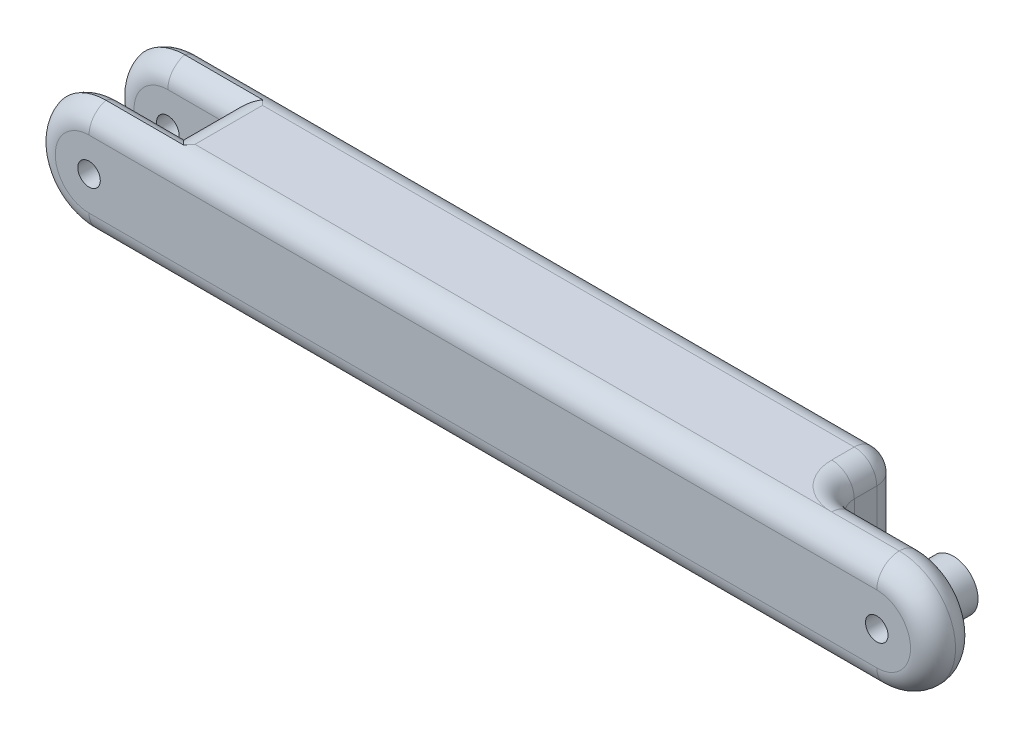
from build123d import *
from build123d.topology import SkipClean

# Parameters (mm, degrees)
SKETCH_1_R               = 0.5
EXTRUDE_1_DEPTH          = 5
CUT_EXTRUDE_1_DEPTH      = 1
CUT_EXTRUDE_1_DEPTH_BACK = 1
CUT_EXTRUDE_1_START      = -2.5
SKETCH_2_R               = 3
SKETCH_7_W               = 8
SKETCH_7_H               = 5
CUT_EXTRUDE_3_DEPTH      = 3
EXTRUDE_START            = 1.4
SKETCH_8_R               = 1.1
SKETCH_8_R_2             = 0.5
EXTRUDE_3_DEPTH          = 1.4
FILLET_1_R               = 1


with BuildPart() as part:
    # 草图1 → 凸台-拉伸1 (new body)
    with BuildSketch(Plane.XY):
        with BuildLine():
            Line((-13.5, 2.5), (21.5, 2.5))
            ThreePointArc((21.5, 2.5), (24, 0), (21.5, -2.5))
            Line((21.5, -2.5), (-13.5, -2.5))
            ThreePointArc((-13.5, -2.5), (-16, 0), (-13.5, 2.5))
        make_face()
        with Locations((-13.5, 0)):
            Circle(SKETCH_1_R, mode=Mode.SUBTRACT)
        with Locations((21.5, 0)):
            Circle(SKETCH_1_R, mode=Mode.SUBTRACT)
    extrude(amount=EXTRUDE_1_DEPTH)

    # 草图2 → 切除-拉伸1 (cut, two sides: drawn at the far end of the back side and taken through both)
    with BuildSketch(Plane(origin=(0, 0, 0), x_dir=(-1, 0, 0), z_dir=(0, 0, -1)).offset(CUT_EXTRUDE_1_START - CUT_EXTRUDE_1_DEPTH_BACK)):
        with Locations((13.5, 0)):
            Circle(SKETCH_2_R)
    extrude(amount=CUT_EXTRUDE_1_DEPTH + CUT_EXTRUDE_1_DEPTH_BACK, mode=Mode.SUBTRACT)

    # 草图7 → 切除-拉伸3 (cut)
    with BuildSketch(Plane(origin=(0, 0, 0), x_dir=(-1, 0, 0), z_dir=(0, 0, -1))):
        with Locations((-21.5, 0)):
            Rectangle(SKETCH_7_W, SKETCH_7_H)
    extrude(amount=-CUT_EXTRUDE_3_DEPTH, mode=Mode.SUBTRACT)

    # 草图8 → 凸台-拉伸3 (add)
    with SkipClean():  # the faces are left unmerged after this step: merging them gives an invalid solid
        with BuildSketch(Plane(origin=(0, 0, 3), x_dir=(-1, 0, 0), z_dir=(0, 0, -1)).offset(EXTRUDE_START)):
            with Locations((-21.5, 0)):
                Circle(SKETCH_8_R)
            with Locations((-21.5, 0)):
                Circle(SKETCH_8_R_2, mode=Mode.SUBTRACT)
        extrude(amount=-EXTRUDE_3_DEPTH)

    # 圆角1
    # the kernel refuses this fillet: 1 mm, written as the material it adds along each edge
    with BuildSketch(Plane(origin=(17.5, 2.5, 3), x_dir=(1, 0, 0), z_dir=(0, -1, 0))) as fillet_1_piece_1:
        with BuildLine():
            CenterArc((FILLET_1_R, -FILLET_1_R), FILLET_1_R, 90, 90)
            Line((0, -FILLET_1_R), (-FILLET_1_R * 0.02, -FILLET_1_R))
            Line((-FILLET_1_R * 0.02, -FILLET_1_R), (-FILLET_1_R * 0.02, FILLET_1_R * 0.02))
            Line((-FILLET_1_R * 0.02, FILLET_1_R * 0.02), (FILLET_1_R, FILLET_1_R * 0.02))
            Line((FILLET_1_R, FILLET_1_R * 0.02), (FILLET_1_R, 0))
        make_face()
    extrude(amount=5)
    # the kernel refuses this fillet: 1 mm, written as the material it takes off along each edge
    with BuildSketch(Plane(origin=(-13.5, -2.5, 1.5), x_dir=(0, 0, -1), z_dir=(1, 0, 0))) as fillet_1_2_piece_1_section:
        with BuildLine():
            CenterArc((FILLET_1_R, FILLET_1_R), FILLET_1_R, 180, 90)
            Line((0, FILLET_1_R), (-FILLET_1_R * 0.02, FILLET_1_R))
            Line((-FILLET_1_R * 0.02, FILLET_1_R), (-FILLET_1_R * 0.02, -FILLET_1_R * 0.02))
            Line((-FILLET_1_R * 0.02, -FILLET_1_R * 0.02), (FILLET_1_R, -FILLET_1_R * 0.02))
            Line((FILLET_1_R, -FILLET_1_R * 0.02), (FILLET_1_R, 0))
        make_face()
    fillet_1_2_piece_1 = extrude(amount=4.158312395, mode=Mode.PRIVATE)
    fillet_1_2_piece_1 = fillet_1_2_piece_1 & Plane(origin=(-13.5, 0, 1.28947416), x_dir=(-1, 0, 0), z_dir=(0, 0, -1)) * Cylinder(3, 13, mode=Mode.PRIVATE)
    add(fillet_1_2_piece_1, mode=Mode.SUBTRACT)
    with BuildSketch(Plane(origin=(-9.341687605, 2.5, 1.5), x_dir=(0, 0, -1), z_dir=(-1, 0, 0))) as fillet_1_2_piece_2_section:
        with BuildLine():
            CenterArc((FILLET_1_R, FILLET_1_R), FILLET_1_R, 180, 90)
            Line((0, FILLET_1_R), (-FILLET_1_R * 0.02, FILLET_1_R))
            Line((-FILLET_1_R * 0.02, FILLET_1_R), (-FILLET_1_R * 0.02, -FILLET_1_R * 0.02))
            Line((-FILLET_1_R * 0.02, -FILLET_1_R * 0.02), (FILLET_1_R, -FILLET_1_R * 0.02))
            Line((FILLET_1_R, -FILLET_1_R * 0.02), (FILLET_1_R, 0))
        make_face()
    fillet_1_2_piece_2 = extrude(amount=4.158312395, mode=Mode.PRIVATE)
    fillet_1_2_piece_2 = fillet_1_2_piece_2 & Plane(origin=(-13.5, 0, 1.289475039), x_dir=(-1, 0, 0), z_dir=(0, 0, -1)) * Cylinder(3, 13, mode=Mode.PRIVATE)
    add(fillet_1_2_piece_2, mode=Mode.SUBTRACT)
    with BuildSketch(Plane(origin=(-13.5, -2.5, 3.5), x_dir=(0, 0, 1), z_dir=(1, 0, 0))) as fillet_1_2_piece_3_section:
        with BuildLine():
            CenterArc((FILLET_1_R, -FILLET_1_R), FILLET_1_R, 90, 90)
            Line((0, -FILLET_1_R), (-FILLET_1_R * 0.02, -FILLET_1_R))
            Line((-FILLET_1_R * 0.02, -FILLET_1_R), (-FILLET_1_R * 0.02, FILLET_1_R * 0.02))
            Line((-FILLET_1_R * 0.02, FILLET_1_R * 0.02), (FILLET_1_R, FILLET_1_R * 0.02))
            Line((FILLET_1_R, FILLET_1_R * 0.02), (FILLET_1_R, 0))
        make_face()
    fillet_1_2_piece_3 = extrude(amount=4.158312395, mode=Mode.PRIVATE)
    fillet_1_2_piece_3 = fillet_1_2_piece_3 & Plane(origin=(-13.5, 0, 3.71052584), x_dir=(-1, 0, 0), z_dir=(0, 0, -1)) * Cylinder(3, 13, mode=Mode.PRIVATE)
    add(fillet_1_2_piece_3, mode=Mode.SUBTRACT)
    with BuildSketch(Plane(origin=(-9.341687605, 2.5, 3.5), x_dir=(0, 0, 1), z_dir=(-1, 0, 0))) as fillet_1_2_piece_4_section:
        with BuildLine():
            CenterArc((FILLET_1_R, -FILLET_1_R), FILLET_1_R, 90, 90)
            Line((0, -FILLET_1_R), (-FILLET_1_R * 0.02, -FILLET_1_R))
            Line((-FILLET_1_R * 0.02, -FILLET_1_R), (-FILLET_1_R * 0.02, FILLET_1_R * 0.02))
            Line((-FILLET_1_R * 0.02, FILLET_1_R * 0.02), (FILLET_1_R, FILLET_1_R * 0.02))
            Line((FILLET_1_R, FILLET_1_R * 0.02), (FILLET_1_R, 0))
        make_face()
    fillet_1_2_piece_4 = extrude(amount=4.158312395, mode=Mode.PRIVATE)
    fillet_1_2_piece_4 = fillet_1_2_piece_4 & Plane(origin=(-13.5, 0, 3.710524961), x_dir=(-1, 0, 0), z_dir=(0, 0, -1)) * Cylinder(3, 13, mode=Mode.PRIVATE)
    add(fillet_1_2_piece_4, mode=Mode.SUBTRACT)
    with BuildSketch(Plane(origin=(-13.5, 0, 5), x_dir=(0, -1, 0), z_dir=(1, 0, 0))) as fillet_1_2_piece_5:
        with BuildLine():
            CenterArc((2.5 - FILLET_1_R, FILLET_1_R), FILLET_1_R, 270, 90)
            Line((2.5, FILLET_1_R), (2.5 + FILLET_1_R * 0.02, FILLET_1_R))
            Line((2.5 + FILLET_1_R * 0.02, FILLET_1_R), (2.5 + FILLET_1_R * 0.02, -FILLET_1_R * 0.02))
            Line((2.5 + FILLET_1_R * 0.02, -FILLET_1_R * 0.02), (2.5 - FILLET_1_R, -FILLET_1_R * 0.02))
            Line((2.5 - FILLET_1_R, -FILLET_1_R * 0.02), (2.5 - FILLET_1_R, 0))
        make_face()
    revolve(axis=Axis((-13.5, 0, 5), (0, 0, -1)), revolution_arc=180, mode=Mode.SUBTRACT)
    with BuildSketch(Plane(origin=(-13.5, 2.5, 5), x_dir=(0, -1, 0), z_dir=(1, 0, 0))) as fillet_1_2_piece_6:
        with BuildLine():
            CenterArc((FILLET_1_R, FILLET_1_R), FILLET_1_R, 180, 90)
            Line((0, FILLET_1_R), (-FILLET_1_R * 0.02, FILLET_1_R))
            Line((-FILLET_1_R * 0.02, FILLET_1_R), (-FILLET_1_R * 0.02, -FILLET_1_R * 0.02))
            Line((-FILLET_1_R * 0.02, -FILLET_1_R * 0.02), (FILLET_1_R, -FILLET_1_R * 0.02))
            Line((FILLET_1_R, -FILLET_1_R * 0.02), (FILLET_1_R, 0))
        make_face()
    extrude(amount=35, mode=Mode.SUBTRACT)
    with BuildSketch(Plane(origin=(21.5, 0, 5), x_dir=(0, 1, 0), z_dir=(-1, 0, 0))) as fillet_1_2_piece_7:
        with BuildLine():
            CenterArc((2.5 - FILLET_1_R, FILLET_1_R), FILLET_1_R, 270, 90)
            Line((2.5 - FILLET_1_R, 0), (2.5 - FILLET_1_R, -FILLET_1_R * 0.02))
            Line((2.5 - FILLET_1_R, -FILLET_1_R * 0.02), (2.5 + FILLET_1_R * 0.02, -FILLET_1_R * 0.02))
            Line((2.5 + FILLET_1_R * 0.02, -FILLET_1_R * 0.02), (2.5 + FILLET_1_R * 0.02, FILLET_1_R))
            Line((2.5 + FILLET_1_R * 0.02, FILLET_1_R), (2.5, FILLET_1_R))
        make_face()
    revolve(axis=Axis((21.5, 0, 5), (0, 0, -1)), revolution_arc=180, mode=Mode.SUBTRACT)
    with BuildSketch(Plane(origin=(-13.5, 2.5, 0), x_dir=(0, 0, 1), z_dir=(1, 0, 0)), Plane(origin=(17.5, -2.5, 0), x_dir=(0, 0, 1), z_dir=(-1, 0, 0))) as fillet_1_2_piece_8:
        with BuildLine():
            CenterArc((FILLET_1_R, FILLET_1_R), FILLET_1_R, 180, 90)
            Line((0, FILLET_1_R), (-FILLET_1_R * 0.02, FILLET_1_R))
            Line((-FILLET_1_R * 0.02, FILLET_1_R), (-FILLET_1_R * 0.02, -FILLET_1_R * 0.02))
            Line((-FILLET_1_R * 0.02, -FILLET_1_R * 0.02), (FILLET_1_R, -FILLET_1_R * 0.02))
            Line((FILLET_1_R, -FILLET_1_R * 0.02), (FILLET_1_R, 0))
        make_face()
    extrude(amount=31, mode=Mode.SUBTRACT)
    with BuildSketch(Plane(origin=(-13.5, 0, 0), x_dir=(0, -1, 0), z_dir=(1, 0, 0))) as fillet_1_2_piece_9:
        with BuildLine():
            CenterArc((2.5 - FILLET_1_R, -FILLET_1_R), FILLET_1_R, 0, 90)
            Line((2.5, -FILLET_1_R), (2.5 + FILLET_1_R * 0.02, -FILLET_1_R))
            Line((2.5 + FILLET_1_R * 0.02, -FILLET_1_R), (2.5 + FILLET_1_R * 0.02, FILLET_1_R * 0.02))
            Line((2.5 + FILLET_1_R * 0.02, FILLET_1_R * 0.02), (2.5 - FILLET_1_R, FILLET_1_R * 0.02))
            Line((2.5 - FILLET_1_R, FILLET_1_R * 0.02), (2.5 - FILLET_1_R, 0))
        make_face()
    revolve(axis=Axis((-13.5, 0, 0), (0, 0, -1)), revolution_arc=180, mode=Mode.SUBTRACT)
    with BuildSketch(Plane(origin=(-13.5, 0, 1.5), x_dir=(0, -1, 0), z_dir=(1, 0, 0))) as fillet_1_2_piece_10:
        with BuildLine():
            CenterArc((2.5 - FILLET_1_R, FILLET_1_R), FILLET_1_R, 270, 90)
            Line((2.5 - FILLET_1_R, 0), (2.5 - FILLET_1_R, -FILLET_1_R * 0.02))
            Line((2.5 - FILLET_1_R, -FILLET_1_R * 0.02), (2.5 + FILLET_1_R * 0.02, -FILLET_1_R * 0.02))
            Line((2.5 + FILLET_1_R * 0.02, -FILLET_1_R * 0.02), (2.5 + FILLET_1_R * 0.02, FILLET_1_R))
            Line((2.5 + FILLET_1_R * 0.02, FILLET_1_R), (2.5, FILLET_1_R))
        make_face()
    revolve(axis=Axis((-13.5, 0, 1.5), (0, 0, -1)), revolution_arc=180, mode=Mode.SUBTRACT)
    with BuildSketch(Plane(origin=(-13.5, 0, 3.5), x_dir=(0, -1, 0), z_dir=(1, 0, 0))) as fillet_1_2_piece_11:
        with BuildLine():
            CenterArc((2.5 - FILLET_1_R, -FILLET_1_R), FILLET_1_R, 0, 90)
            Line((2.5, -FILLET_1_R), (2.5 + FILLET_1_R * 0.02, -FILLET_1_R))
            Line((2.5 + FILLET_1_R * 0.02, -FILLET_1_R), (2.5 + FILLET_1_R * 0.02, FILLET_1_R * 0.02))
            Line((2.5 + FILLET_1_R * 0.02, FILLET_1_R * 0.02), (2.5 - FILLET_1_R, FILLET_1_R * 0.02))
            Line((2.5 - FILLET_1_R, FILLET_1_R * 0.02), (2.5 - FILLET_1_R, 0))
        make_face()
    revolve(axis=Axis((-13.5, 0, 3.5), (0, 0, -1)), revolution_arc=180, mode=Mode.SUBTRACT)
    with BuildSketch(Plane(origin=(-11.841687605, 2.5, 1.5), x_dir=(1, 0, 0), z_dir=(0, 0, 1)), Plane(origin=(-11.841687605, -2.5, 3.5), x_dir=(1, 0, 0), z_dir=(0, 0, -1))) as fillet_1_2_piece_12:
        with BuildLine():
            CenterArc((2.049786848, -1), FILLET_1_R, 90, 112.024312837)
            Line((1.122762037, -1.375), (1.104221541, -1.3825))
            ThreePointArc((1.104221541, -1.3825), (0.649920512, -0.615202704), (-0.011055416, -0.016666667))
            Line((-0.011055416, -0.016666667), (0, 0.02))
            Line((0, 0.02), (2.049786848, 0.02))
            Line((2.049786848, 0.02), (2.049786848, 0))
        make_face()
    extrude(amount=2, mode=Mode.SUBTRACT)
    with BuildSketch(Plane(origin=(21.5, -2.5, 5), x_dir=(0, 0, -1), z_dir=(-1, 0, 0))) as fillet_1_2_piece_13:
        with BuildLine():
            CenterArc((FILLET_1_R, -FILLET_1_R), FILLET_1_R, 90, 90)
            Line((0, -FILLET_1_R), (-FILLET_1_R * 0.02, -FILLET_1_R))
            Line((-FILLET_1_R * 0.02, -FILLET_1_R), (-FILLET_1_R * 0.02, FILLET_1_R * 0.02))
            Line((-FILLET_1_R * 0.02, FILLET_1_R * 0.02), (FILLET_1_R, FILLET_1_R * 0.02))
            Line((FILLET_1_R, FILLET_1_R * 0.02), (FILLET_1_R, 0))
        make_face()
    extrude(amount=35, mode=Mode.SUBTRACT)
    with BuildSketch(Plane(origin=(17.5, 2.5, 0), x_dir=(-1, 0, 0), z_dir=(0, -1, 0))) as fillet_1_2_piece_14:
        with BuildLine():
            CenterArc((FILLET_1_R, -FILLET_1_R), FILLET_1_R, 90, 90)
            Line((0, -FILLET_1_R), (-FILLET_1_R * 0.02, -FILLET_1_R))
            Line((-FILLET_1_R * 0.02, -FILLET_1_R), (-FILLET_1_R * 0.02, FILLET_1_R * 0.02))
            Line((-FILLET_1_R * 0.02, FILLET_1_R * 0.02), (FILLET_1_R, FILLET_1_R * 0.02))
            Line((FILLET_1_R, FILLET_1_R * 0.02), (FILLET_1_R, 0))
        make_face()
    extrude(amount=5, mode=Mode.SUBTRACT)
    with BuildSketch(Plane(origin=(-13.5, -2.5, 1.5), x_dir=(0, 0, -1), z_dir=(1, 0, 0))) as fillet_1_2_piece_15a_section:
        with BuildLine():
            CenterArc((FILLET_1_R, FILLET_1_R), FILLET_1_R, 180, 90)
            Line((0, FILLET_1_R), (-FILLET_1_R * 0.02, FILLET_1_R))
            Line((-FILLET_1_R * 0.02, FILLET_1_R), (-FILLET_1_R * 0.02, -FILLET_1_R * 0.02))
            Line((-FILLET_1_R * 0.02, -FILLET_1_R * 0.02), (FILLET_1_R, -FILLET_1_R * 0.02))
            Line((FILLET_1_R, -FILLET_1_R * 0.02), (FILLET_1_R, 0))
        make_face()
    fillet_1_2_piece_15a = extrude(amount=4.158312395, mode=Mode.PRIVATE)
    fillet_1_2_piece_15a = fillet_1_2_piece_15a - Plane(origin=(-13.5, 0, 1.259839383), x_dir=(-1, 0, 0), z_dir=(0, 0, -1)) * Cylinder(3, 13, mode=Mode.PRIVATE)
    with BuildSketch(Plane(origin=(-11.841687605, -2.5, 3.5), x_dir=(1, 0, 0), z_dir=(0, 0, -1))) as fillet_1_2_piece_15b_section:
        with BuildLine():
            CenterArc((2.049786848, -1), FILLET_1_R, 90, 112.024312837)
            Line((1.122762037, -1.375), (1.104221541, -1.3825))
            ThreePointArc((1.104221541, -1.3825), (0.649920512, -0.615202704), (-0.011055416, -0.016666667))
            Line((-0.011055416, -0.016666667), (0, 0.02))
            Line((0, 0.02), (2.049786848, 0.02))
            Line((2.049786848, 0.02), (2.049786848, 0))
        make_face()
    fillet_1_2_piece_15b = extrude(amount=7.124467121, mode=Mode.PRIVATE)
    fillet_1_2_piece_15b = split(fillet_1_2_piece_15b, bisect_by=Plane(origin=(-10.955873781, -2.177051109, 1.5), z_dir=(0, 0, -1)), keep=Keep.TOP, mode=Mode.PRIVATE)
    fillet_1_2_piece_15 = fillet_1_2_piece_15a & fillet_1_2_piece_15b
    add(fillet_1_2_piece_15, mode=Mode.SUBTRACT)
    with BuildSketch(Plane(origin=(-11.841687605, 2.5, -3.624467121), x_dir=(1, 0, 0), z_dir=(0, 0, 1))) as fillet_1_2_piece_16a_section:
        with BuildLine():
            CenterArc((2.049786848, -1), FILLET_1_R, 90, 112.024312837)
            Line((1.122762037, -1.375), (1.104221541, -1.3825))
            ThreePointArc((1.104221541, -1.3825), (0.649920512, -0.615202704), (-0.011055416, -0.016666667))
            Line((-0.011055416, -0.016666667), (0, 0.02))
            Line((0, 0.02), (2.049786848, 0.02))
            Line((2.049786848, 0.02), (2.049786848, 0))
        make_face()
    fillet_1_2_piece_16a = extrude(amount=7.124467121, mode=Mode.PRIVATE)
    fillet_1_2_piece_16a = split(fillet_1_2_piece_16a, bisect_by=Plane(origin=(-10.955873781, 2.177051109, 1.5), z_dir=(0, 0, -1)), keep=Keep.TOP, mode=Mode.PRIVATE)
    with BuildSketch(Plane(origin=(-9.341687605, 2.5, 1.5), x_dir=(0, 0, -1), z_dir=(-1, 0, 0))) as fillet_1_2_piece_16b_section:
        with BuildLine():
            CenterArc((FILLET_1_R, FILLET_1_R), FILLET_1_R, 180, 90)
            Line((0, FILLET_1_R), (-FILLET_1_R * 0.02, FILLET_1_R))
            Line((-FILLET_1_R * 0.02, FILLET_1_R), (-FILLET_1_R * 0.02, -FILLET_1_R * 0.02))
            Line((-FILLET_1_R * 0.02, -FILLET_1_R * 0.02), (FILLET_1_R, -FILLET_1_R * 0.02))
            Line((FILLET_1_R, -FILLET_1_R * 0.02), (FILLET_1_R, 0))
        make_face()
    fillet_1_2_piece_16b = extrude(amount=4.158312395, mode=Mode.PRIVATE)
    fillet_1_2_piece_16b = fillet_1_2_piece_16b - Plane(origin=(-13.5, 0, 1.259838183), x_dir=(-1, 0, 0), z_dir=(0, 0, -1)) * Cylinder(3, 13, mode=Mode.PRIVATE)
    fillet_1_2_piece_16 = fillet_1_2_piece_16a & fillet_1_2_piece_16b
    add(fillet_1_2_piece_16, mode=Mode.SUBTRACT)
    with BuildSketch(Plane(origin=(-11.841687605, -2.5, 8.624467121), x_dir=(1, 0, 0), z_dir=(0, 0, -1))) as fillet_1_2_piece_17a_section:
        with BuildLine():
            CenterArc((2.049786848, -1), FILLET_1_R, 90, 112.024312837)
            Line((1.122762037, -1.375), (1.104221541, -1.3825))
            ThreePointArc((1.104221541, -1.3825), (0.649920512, -0.615202704), (-0.011055416, -0.016666667))
            Line((-0.011055416, -0.016666667), (0, 0.02))
            Line((0, 0.02), (2.049786848, 0.02))
            Line((2.049786848, 0.02), (2.049786848, 0))
        make_face()
    fillet_1_2_piece_17a = extrude(amount=7.124467121, mode=Mode.PRIVATE)
    fillet_1_2_piece_17a = split(fillet_1_2_piece_17a, bisect_by=Plane(origin=(-10.955873781, -2.177051109, 3.5), z_dir=(0, 0, 1)), keep=Keep.TOP, mode=Mode.PRIVATE)
    with BuildSketch(Plane(origin=(-13.5, -2.5, 3.5), x_dir=(0, 0, 1), z_dir=(1, 0, 0))) as fillet_1_2_piece_17b_section:
        with BuildLine():
            CenterArc((FILLET_1_R, -FILLET_1_R), FILLET_1_R, 90, 90)
            Line((0, -FILLET_1_R), (-FILLET_1_R * 0.02, -FILLET_1_R))
            Line((-FILLET_1_R * 0.02, -FILLET_1_R), (-FILLET_1_R * 0.02, FILLET_1_R * 0.02))
            Line((-FILLET_1_R * 0.02, FILLET_1_R * 0.02), (FILLET_1_R, FILLET_1_R * 0.02))
            Line((FILLET_1_R, FILLET_1_R * 0.02), (FILLET_1_R, 0))
        make_face()
    fillet_1_2_piece_17b = extrude(amount=4.158312395, mode=Mode.PRIVATE)
    fillet_1_2_piece_17b = fillet_1_2_piece_17b - Plane(origin=(-13.5, 0, 3.740160617), x_dir=(-1, 0, 0), z_dir=(0, 0, -1)) * Cylinder(3, 13, mode=Mode.PRIVATE)
    fillet_1_2_piece_17 = fillet_1_2_piece_17a & fillet_1_2_piece_17b
    add(fillet_1_2_piece_17, mode=Mode.SUBTRACT)
    with BuildSketch(Plane(origin=(-9.341687605, 2.5, 3.5), x_dir=(0, 0, 1), z_dir=(-1, 0, 0))) as fillet_1_2_piece_18a_section:
        with BuildLine():
            CenterArc((FILLET_1_R, -FILLET_1_R), FILLET_1_R, 90, 90)
            Line((0, -FILLET_1_R), (-FILLET_1_R * 0.02, -FILLET_1_R))
            Line((-FILLET_1_R * 0.02, -FILLET_1_R), (-FILLET_1_R * 0.02, FILLET_1_R * 0.02))
            Line((-FILLET_1_R * 0.02, FILLET_1_R * 0.02), (FILLET_1_R, FILLET_1_R * 0.02))
            Line((FILLET_1_R, FILLET_1_R * 0.02), (FILLET_1_R, 0))
        make_face()
    fillet_1_2_piece_18a = extrude(amount=4.158312395, mode=Mode.PRIVATE)
    fillet_1_2_piece_18a = fillet_1_2_piece_18a - Plane(origin=(-13.5, 0, 3.740161817), x_dir=(-1, 0, 0), z_dir=(0, 0, -1)) * Cylinder(3, 13, mode=Mode.PRIVATE)
    with BuildSketch(Plane(origin=(-11.841687605, 2.5, 1.5), x_dir=(1, 0, 0), z_dir=(0, 0, 1))) as fillet_1_2_piece_18b_section:
        with BuildLine():
            CenterArc((2.049786848, -1), FILLET_1_R, 90, 112.024312837)
            Line((1.122762037, -1.375), (1.104221541, -1.3825))
            ThreePointArc((1.104221541, -1.3825), (0.649920512, -0.615202704), (-0.011055416, -0.016666667))
            Line((-0.011055416, -0.016666667), (0, 0.02))
            Line((0, 0.02), (2.049786848, 0.02))
            Line((2.049786848, 0.02), (2.049786848, 0))
        make_face()
    fillet_1_2_piece_18b = extrude(amount=7.124467121, mode=Mode.PRIVATE)
    fillet_1_2_piece_18b = split(fillet_1_2_piece_18b, bisect_by=Plane(origin=(-10.955873781, 2.177051109, 3.5), z_dir=(0, 0, 1)), keep=Keep.TOP, mode=Mode.PRIVATE)
    fillet_1_2_piece_18 = fillet_1_2_piece_18a & fillet_1_2_piece_18b
    add(fillet_1_2_piece_18, mode=Mode.SUBTRACT)
    with BuildSketch(Plane(origin=(-13.5, 2.5, 0), x_dir=(0, 0, 1), z_dir=(1, 0, 0))) as fillet_1_2_piece_19a_section:
        with BuildLine():
            CenterArc((FILLET_1_R, FILLET_1_R), FILLET_1_R, 180, 90)
            Line((0, FILLET_1_R), (-FILLET_1_R * 0.02, FILLET_1_R))
            Line((-FILLET_1_R * 0.02, FILLET_1_R), (-FILLET_1_R * 0.02, -FILLET_1_R * 0.02))
            Line((-FILLET_1_R * 0.02, -FILLET_1_R * 0.02), (FILLET_1_R, -FILLET_1_R * 0.02))
            Line((FILLET_1_R, -FILLET_1_R * 0.02), (FILLET_1_R, 0))
        make_face()
    fillet_1_2_piece_19a = extrude(amount=33.5, mode=Mode.PRIVATE)
    fillet_1_2_piece_19a = split(fillet_1_2_piece_19a, bisect_by=Plane(origin=(17.5, 2.273604886, 0.226395114), z_dir=(1, 0, 0)), keep=Keep.TOP, mode=Mode.PRIVATE)
    with BuildSketch(Plane(origin=(17.5, 5, 0), x_dir=(-1, 0, 0), z_dir=(0, -1, 0))) as fillet_1_2_piece_19b_section:
        with BuildLine():
            CenterArc((FILLET_1_R, -FILLET_1_R), FILLET_1_R, 90, 90)
            Line((0, -FILLET_1_R), (-FILLET_1_R * 0.02, -FILLET_1_R))
            Line((-FILLET_1_R * 0.02, -FILLET_1_R), (-FILLET_1_R * 0.02, FILLET_1_R * 0.02))
            Line((-FILLET_1_R * 0.02, FILLET_1_R * 0.02), (FILLET_1_R, FILLET_1_R * 0.02))
            Line((FILLET_1_R, FILLET_1_R * 0.02), (FILLET_1_R, 0))
        make_face()
    fillet_1_2_piece_19b = extrude(amount=7.5, mode=Mode.PRIVATE)
    fillet_1_2_piece_19b = split(fillet_1_2_piece_19b, bisect_by=Plane(origin=(17.273604886, 2.5, 0.226395114), z_dir=(0, 1, 0)), keep=Keep.TOP, mode=Mode.PRIVATE)
    fillet_1_2_piece_19 = fillet_1_2_piece_19a & fillet_1_2_piece_19b
    add(fillet_1_2_piece_19, mode=Mode.SUBTRACT)
    with BuildSketch(Plane(origin=(20, -2.5, 0), x_dir=(0, 0, 1), z_dir=(-1, 0, 0))) as fillet_1_2_piece_20a_section:
        with BuildLine():
            CenterArc((FILLET_1_R, FILLET_1_R), FILLET_1_R, 180, 90)
            Line((0, FILLET_1_R), (-FILLET_1_R * 0.02, FILLET_1_R))
            Line((-FILLET_1_R * 0.02, FILLET_1_R), (-FILLET_1_R * 0.02, -FILLET_1_R * 0.02))
            Line((-FILLET_1_R * 0.02, -FILLET_1_R * 0.02), (FILLET_1_R, -FILLET_1_R * 0.02))
            Line((FILLET_1_R, -FILLET_1_R * 0.02), (FILLET_1_R, 0))
        make_face()
    fillet_1_2_piece_20a = extrude(amount=33.5, mode=Mode.PRIVATE)
    fillet_1_2_piece_20a = split(fillet_1_2_piece_20a, bisect_by=Plane(origin=(17.5, -2.273604886, 0.226395114), z_dir=(1, 0, 0)), keep=Keep.TOP, mode=Mode.PRIVATE)
    with BuildSketch(Plane(origin=(17.5, 2.5, 0), x_dir=(-1, 0, 0), z_dir=(0, -1, 0))) as fillet_1_2_piece_20b_section:
        with BuildLine():
            CenterArc((FILLET_1_R, -FILLET_1_R), FILLET_1_R, 90, 90)
            Line((0, -FILLET_1_R), (-FILLET_1_R * 0.02, -FILLET_1_R))
            Line((-FILLET_1_R * 0.02, -FILLET_1_R), (-FILLET_1_R * 0.02, FILLET_1_R * 0.02))
            Line((-FILLET_1_R * 0.02, FILLET_1_R * 0.02), (FILLET_1_R, FILLET_1_R * 0.02))
            Line((FILLET_1_R, FILLET_1_R * 0.02), (FILLET_1_R, 0))
        make_face()
    fillet_1_2_piece_20b = extrude(amount=7.5, mode=Mode.PRIVATE)
    fillet_1_2_piece_20b = split(fillet_1_2_piece_20b, bisect_by=Plane(origin=(17.273604886, -2.5, 0.226395114), z_dir=(0, -1, 0)), keep=Keep.TOP, mode=Mode.PRIVATE)
    fillet_1_2_piece_20 = fillet_1_2_piece_20a & fillet_1_2_piece_20b
    add(fillet_1_2_piece_20, mode=Mode.SUBTRACT)
    # the kernel refuses this fillet: 1 mm, written as the material it takes off along each edge
    with BuildSketch(Plane(origin=(16.5, -1.5, 1), x_dir=(1, 0, 0), z_dir=(0, -1, 0))) as fillet_1_3_piece_1_section:
        Polygon((0, 0), (FILLET_1_R * 1.02, 0), (FILLET_1_R * 1.02, -FILLET_1_R * 1.02), (0, -FILLET_1_R * 1.02), align=None)
    fillet_1_3_piece_1 = extrude(amount=FILLET_1_R * 1.02, mode=Mode.PRIVATE)
    fillet_1_3_piece_1 = fillet_1_3_piece_1 - Plane(origin=(16.5, -1.5, 1), x_dir=(-0.7071067811865475, 0, 0.7071067811865475), z_dir=(0, -1, 0)) * Sphere(FILLET_1_R, mode=Mode.PRIVATE)
    add(fillet_1_3_piece_1, mode=Mode.SUBTRACT)
    with BuildSketch(Plane(origin=(16.5, 1.5, 1), x_dir=(1, 0, 0), z_dir=(0, 1, 0))) as fillet_1_3_piece_2_section:
        Polygon((0, 0), (FILLET_1_R * 1.02, 0), (FILLET_1_R * 1.02, FILLET_1_R * 1.02), (0, FILLET_1_R * 1.02), align=None)
    fillet_1_3_piece_2 = extrude(amount=FILLET_1_R * 1.02, mode=Mode.PRIVATE)
    fillet_1_3_piece_2 = fillet_1_3_piece_2 - Plane(origin=(16.5, 1.5, 1), x_dir=(-0.7071067811865475, 0, 0.7071067811865475), z_dir=(0, 1, 0)) * Sphere(FILLET_1_R, mode=Mode.PRIVATE)
    add(fillet_1_3_piece_2, mode=Mode.SUBTRACT)
    with BuildSketch(Plane(origin=(17.5, 2.5, 1), x_dir=(-1, 0, 0), z_dir=(0, 0, 1))) as fillet_1_3_piece_3:
        with BuildLine():
            CenterArc((FILLET_1_R, FILLET_1_R), FILLET_1_R, 180, 90)
            Line((0, FILLET_1_R), (-FILLET_1_R * 0.02, FILLET_1_R))
            Line((-FILLET_1_R * 0.02, FILLET_1_R), (-FILLET_1_R * 0.02, -FILLET_1_R * 0.02))
            Line((-FILLET_1_R * 0.02, -FILLET_1_R * 0.02), (FILLET_1_R, -FILLET_1_R * 0.02))
            Line((FILLET_1_R, -FILLET_1_R * 0.02), (FILLET_1_R, 0))
        make_face()
    extrude(amount=1, mode=Mode.SUBTRACT)
    with BuildSketch(Plane(origin=(21.5, 2.5, 3), x_dir=(0, -1, 0), z_dir=(-1, 0, 0)), Plane(origin=(18.5, -2.5, 3), x_dir=(0, 1, 0), z_dir=(1, 0, 0))) as fillet_1_3_piece_4:
        with BuildLine():
            CenterArc((FILLET_1_R, FILLET_1_R), FILLET_1_R, 180, 90)
            Line((0, FILLET_1_R), (-FILLET_1_R * 0.02, FILLET_1_R))
            Line((-FILLET_1_R * 0.02, FILLET_1_R), (-FILLET_1_R * 0.02, -FILLET_1_R * 0.02))
            Line((-FILLET_1_R * 0.02, -FILLET_1_R * 0.02), (FILLET_1_R, -FILLET_1_R * 0.02))
            Line((FILLET_1_R, -FILLET_1_R * 0.02), (FILLET_1_R, 0))
        make_face()
    extrude(amount=3, mode=Mode.SUBTRACT)
    with BuildSketch(Plane(origin=(21.5, 0, 3), x_dir=(0, 1, 0), z_dir=(-1, 0, 0))) as fillet_1_3_piece_5:
        with BuildLine():
            CenterArc((2.5 - FILLET_1_R, -FILLET_1_R), FILLET_1_R, 0, 90)
            Line((2.5 - FILLET_1_R, 0), (2.5 - FILLET_1_R, FILLET_1_R * 0.02))
            Line((2.5 - FILLET_1_R, FILLET_1_R * 0.02), (2.5 + FILLET_1_R * 0.02, FILLET_1_R * 0.02))
            Line((2.5 + FILLET_1_R * 0.02, FILLET_1_R * 0.02), (2.5 + FILLET_1_R * 0.02, -FILLET_1_R))
            Line((2.5 + FILLET_1_R * 0.02, -FILLET_1_R), (2.5, -FILLET_1_R))
        make_face()
    revolve(axis=Axis((21.5, 0, 3), (0, 0, -1)), revolution_arc=180, mode=Mode.SUBTRACT)
    with BuildSketch(Plane(origin=(17.5, -2.5, 1), x_dir=(-1, 0, 0), z_dir=(0, 0, 1))) as fillet_1_3_piece_6:
        with BuildLine():
            CenterArc((FILLET_1_R, -FILLET_1_R), FILLET_1_R, 90, 90)
            Line((0, -FILLET_1_R), (-FILLET_1_R * 0.02, -FILLET_1_R))
            Line((-FILLET_1_R * 0.02, -FILLET_1_R), (-FILLET_1_R * 0.02, FILLET_1_R * 0.02))
            Line((-FILLET_1_R * 0.02, FILLET_1_R * 0.02), (FILLET_1_R, FILLET_1_R * 0.02))
            Line((FILLET_1_R, FILLET_1_R * 0.02), (FILLET_1_R, 0))
        make_face()
    extrude(amount=1, mode=Mode.SUBTRACT)
    with BuildSketch(Plane(origin=(18.5, -2.5, 2), x_dir=(0, 0, 1), z_dir=(1, 0, 0))) as fillet_1_3_piece_7:
        with BuildLine():
            CenterArc((1 + FILLET_1_R, -FILLET_1_R), FILLET_1_R, 90, 90)
            Line((1 + FILLET_1_R, 0), (1 + FILLET_1_R, FILLET_1_R * 0.02))
            Line((1 + FILLET_1_R, FILLET_1_R * 0.02), (1 - FILLET_1_R * 0.02, FILLET_1_R * 0.02))
            Line((1 - FILLET_1_R * 0.02, FILLET_1_R * 0.02), (1 - FILLET_1_R * 0.02, -FILLET_1_R))
            Line((1 - FILLET_1_R * 0.02, -FILLET_1_R), (1, -FILLET_1_R))
        make_face()
    revolve(axis=Axis((18.5, -2.5, 2), (0, -1, 0)), revolution_arc=90, mode=Mode.SUBTRACT)
    with BuildSketch(Plane(origin=(18.5, 2.5, 2), x_dir=(0, 0, 1), z_dir=(1, 0, 0))) as fillet_1_3_piece_8:
        with BuildLine():
            CenterArc((1 + FILLET_1_R, FILLET_1_R), FILLET_1_R, 180, 90)
            Line((1 + FILLET_1_R, 0), (1 + FILLET_1_R, -FILLET_1_R * 0.02))
            Line((1 + FILLET_1_R, -FILLET_1_R * 0.02), (1 - FILLET_1_R * 0.02, -FILLET_1_R * 0.02))
            Line((1 - FILLET_1_R * 0.02, -FILLET_1_R * 0.02), (1 - FILLET_1_R * 0.02, FILLET_1_R))
            Line((1 - FILLET_1_R * 0.02, FILLET_1_R), (1, FILLET_1_R))
        make_face()
    revolve(axis=Axis((18.5, 2.5, 2), (0, -1, 0)), revolution_arc=90, mode=Mode.SUBTRACT)


solid = part.part
